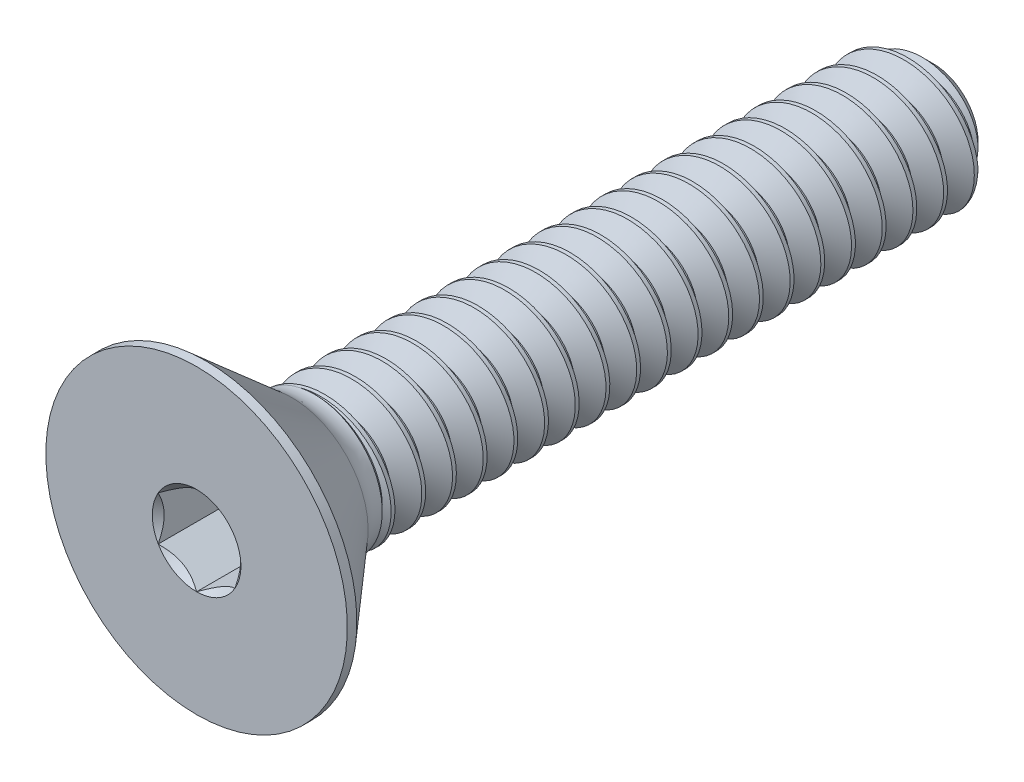
from build123d import *

# Parameters (mm, degrees)
SKETCH1_W          = 19.05
SKETCH1_H          = 1.7526
CHAMFER1_SIZE      = 0.5953125
CUT_SWEEP1_PITCH   = 0.79375
CUT_EXTRUDE2_DEPTH = 1.72466


with BuildPart() as part:
    # Sketch1 → Revolve1 (revolve)
    with BuildSketch(Plane(origin=(0, 0, 0), x_dir=(0, 0, -1), z_dir=(1, 0, 0))):
        with Locations((9.525, 0.8763)):
            Rectangle(SKETCH1_W, SKETCH1_H)
    revolve(axis=Axis((0, 0, -19.05), (0, 0, 1)))

    # Chamfer1
    chamfer1_edges = [part.edges().sort_by_distance(p)[0] for p in [
        (0, -1.7526, -19.05),
    ]]
    chamfer(chamfer1_edges, length=CHAMFER1_SIZE)

    # Cut-Sweep1: arcs per turn and ends read off the stored shape
    # Cut-Sweep1: the profile of Sketch2 profile screwed along a right-hand helix through 25 turns, 8 arcs to a turn; built about Z, then put on its axis
    cut_sweep1_z = Axis((0, 0, 0), (0, 0, 1))
    cut_sweep1_corners = [(1.7529, 0, 0.000173205), (1.7529, 0, -0.694704455), (1.237044252, 0, -0.396875), (1.237044252, 0, -0.29765625)]
    with BuildLine(mode=Mode.PRIVATE) as cut_sweep1_profile:
        Line(cut_sweep1_corners[0], cut_sweep1_corners[1])
        Line(cut_sweep1_corners[1], cut_sweep1_corners[2])
        Line(cut_sweep1_corners[2], cut_sweep1_corners[3])
        Line(cut_sweep1_corners[3], cut_sweep1_corners[0])
    cut_sweep1_cap = Face(cut_sweep1_profile.wire())
    cut_sweep1_turn_angles = [0, 22.5, 45, 67.5, 90, 112.5, 135, 157.5, 180, 202.5, 225, 247.5, 270, 292.5, 315, 337.5, 360]
    cut_sweep1_turn_weights = [1, 0.9238795325112867, 1, 0.9238795325112867, 1, 0.9238795325112867, 1, 0.9238795325112867, 1, 0.9238795325112867, 1, 0.9238795325112867, 1, 0.9238795325112867, 1, 0.9238795325112867, 1]
    cut_sweep1_turn_rails = [Edge.make_bspline([Vector(p[0], p[1], 0).rotate(cut_sweep1_z, cut_sweep1_turn_angles[k]) / cut_sweep1_turn_weights[k] + Vector(0, 0, p[2] + CUT_SWEEP1_PITCH * cut_sweep1_turn_angles[k] / 360) for k in range(17)], [0, 0, 0, 1, 1, 2, 2, 3, 3, 4, 4, 5, 5, 6, 6, 7, 7, 8, 8, 8], 2, cut_sweep1_turn_weights) for p in cut_sweep1_corners]
    cut_sweep1_turn_sides = [Face.make_surface_from_curves(cut_sweep1_turn_rails[p[0]], cut_sweep1_turn_rails[p[1]]) for p in [(0, 1), (1, 2), (2, 3), (3, 0)]]
    cut_sweep1 = Plane(origin=(0, 0, -19.05), x_dir=(0, 1, 0), z_dir=(0, 0, 1)) * Solid(Shell([*[p.moved(Location((0, 0, CUT_SWEEP1_PITCH * i))) for i in range(25) for p in cut_sweep1_turn_sides], cut_sweep1_cap, cut_sweep1_cap.rotate(cut_sweep1_z, 9000).moved(Location((0, 0, CUT_SWEEP1_PITCH * 9000 / 360)))]))
    add(cut_sweep1, mode=Mode.SUBTRACT)

    # Sketch7 → Revolve2 (revolve)
    with BuildSketch(Plane(origin=(0, 0, 0), x_dir=(0, 0, -1), z_dir=(1, 0, 0)), mode=Mode.PRIVATE) as revolve2_sk:
        with BuildLine():
            Line((0, 3.8989), (0.24638, 3.8989))
            Line((0.24638, 3.8989), (2.4638, 1.971326202))
            ThreePointArc((2.4638, 1.971326202), (2.73652883, 1.809069598), (3.048809801, 1.7526))
            Line((3.048809801, 1.7526), (3.048809801, 0))
            Line((3.048809801, 0), (0, 0))
            Line((0, 0), (0, 3.8989))
        make_face()
    revolve(revolve2_sk.sketch.rotate(Axis((0, 0, 0), (0, 0, -1)), 189.052465709), axis=Axis((0, 0, 0), (0, 0, -1)))

    # Boss-Extrude1 cone 1 section (through the dimple's axis) → Boss-Extrude1 (revolve)
    with BuildSketch(Plane(origin=(0, 0, -3.048809801), x_dir=(0, -1, 0), z_dir=(1, 0, 0))):
        Polygon((0, 0), (1.7526, 0), (0, 1.7526), align=None)
    revolve(axis=Axis((0, 0, -3.048809801), (0, 0, -1)))

    # Sketch5 → Cut-Extrude2 (cut)
    with BuildSketch(Plane.XY):
        Polygon((0.9921875, -0.57283972), (0.9921875, 0.57283972), (0, 1.14567944), (-0.9921875, 0.57283972), (-0.9921875, -0.57283972), (0, -1.14567944), align=None)
    extrude(amount=-CUT_EXTRUDE2_DEPTH, mode=Mode.SUBTRACT)

    # Cut-Extrude3 cone 1 section (through the dimple's axis) → Cut-Extrude3 (revolve, cut)
    with BuildSketch(Plane(origin=(0, 0, 0), x_dir=(0, -1, 0), z_dir=(1, 0, 0))):
        Polygon((0, 0), (1.14567944, 0), (0, 1.14567944), align=None)
    revolve(axis=Axis((0, 0, 0), (0, 0, -1)), mode=Mode.SUBTRACT)


solid = part.part
